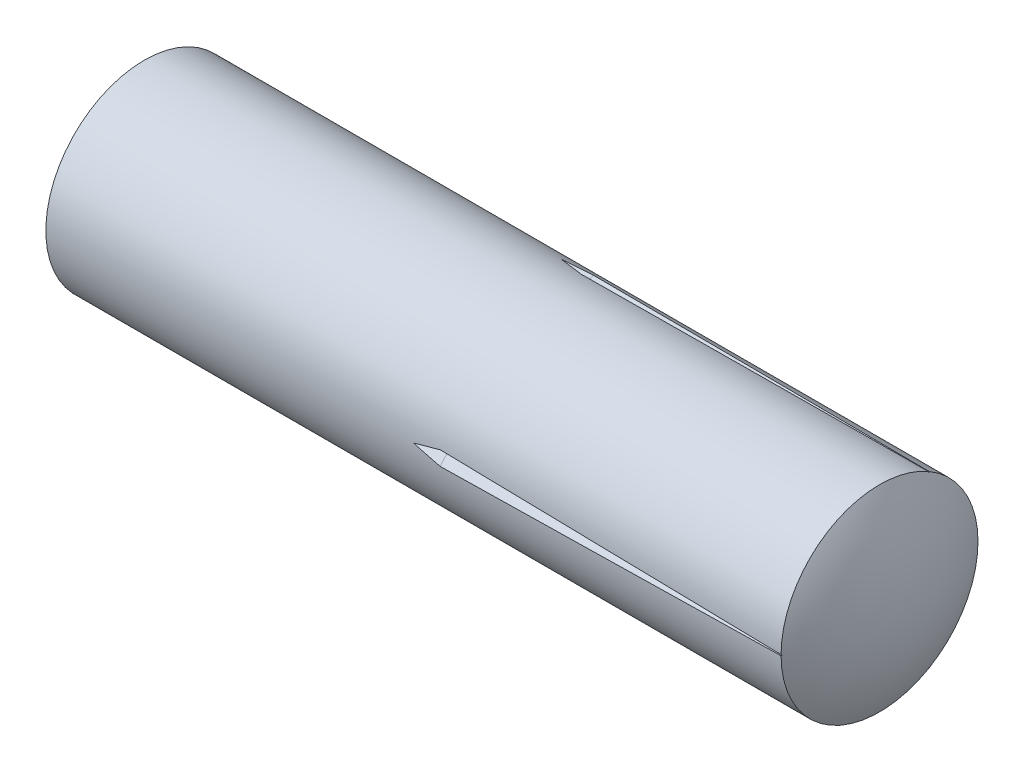
from build123d import *

# Parameters (mm, degrees)
CIRPATTERN1_COUNT = 3


with BuildPart() as part:
    # Sketch1 → Base-Revolve (revolve)
    with BuildSketch(Plane.XY):
        with BuildLine():
            Line((-50, 0), (-50, 1.25))
            ThreePointArc((-50, 1.25), (-49.010050505, 7.072345027), (-46.68190465, 12.5))
            Line((-46.68190465, 12.5), (46.650635095, 12.5))
            ThreePointArc((46.650635095, 12.5), (49.148145657, 6.470476128), (50, 0))
            Line((50, 0), (-50, 0))
        make_face()
    revolve(axis=Axis((-57, 0, 0), (1, 0, 0)))

    # Cut-Sweep1: sweep along a path in Sketch3
    with BuildLine(Plane(origin=(0, 0, 0), x_dir=(1, 0, 0), z_dir=(0, 1, 0))) as cut_sweep1_path:
        Line((0, -12.5), (3.125, -11.25))
        Line((3.125, -11.25), (50, -12.5))
    # Sketch2 → Cut-Sweep1 (sweep, cut)
    with BuildSketch(Plane(origin=(0, 0, 0), x_dir=(0, 0, -1), z_dir=(1, 0, 0))):
        Polygon((-12.5, 0), (-14.378358908, 1.315241067), (-14.378358908, -1.315241067), align=None)
    cut_sweep1 = sweep(path=cut_sweep1_path.line, transition=Transition.RIGHT, mode=Mode.SUBTRACT)

    # CirPattern1: Cut-Sweep1 ×3 about axis
    cirpattern1_axis = Axis((-57, 0, 0), (1, 0, 0))
    for i in range(1, CIRPATTERN1_COUNT):
        add(cut_sweep1.rotate(cirpattern1_axis, i * 360 / CIRPATTERN1_COUNT), mode=Mode.SUBTRACT)


solid = part.part
